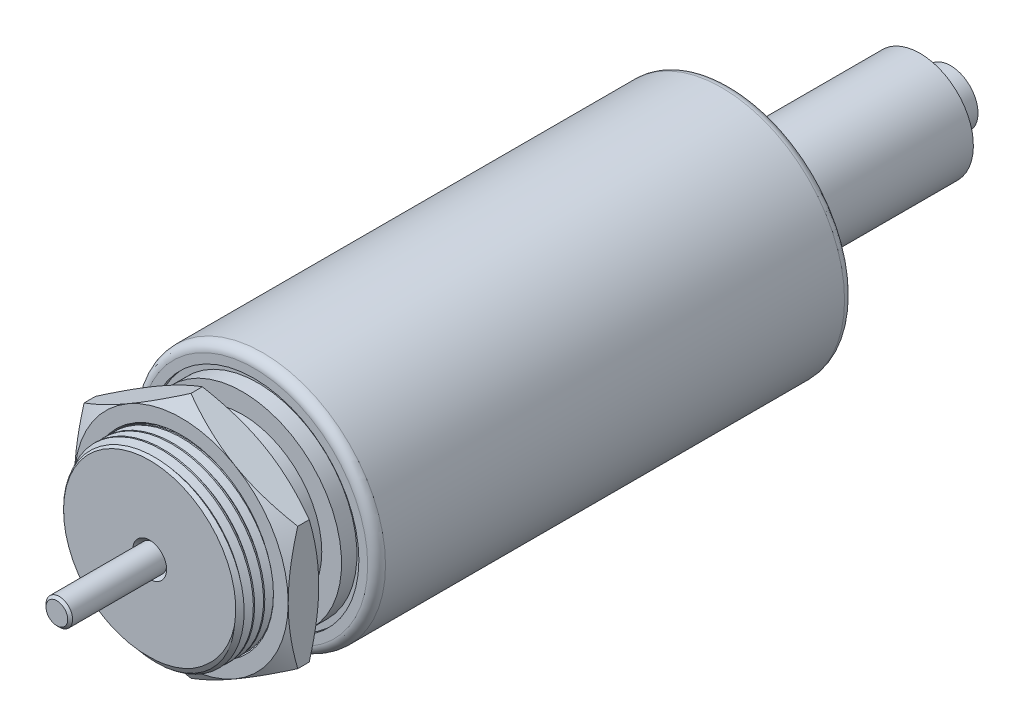
from build123d import *

# Parameters (mm, degrees)
CUT_SWEEP1_PITCH    = 1.058333333
BOSS_EXTRUDE3_START = 3.175
SKETCH10_R          = 9.46404
BOSS_EXTRUDE3_DEPTH = 3.175


with BuildPart() as part:
    # Sketch1 → Revolve1 (revolve)
    with BuildSketch(Plane(origin=(0, 0, 0), x_dir=(0, 0, -1), z_dir=(1, 0, 0)), mode=Mode.PRIVATE) as revolve1_sk:
        with BuildLine():
            Line((49.8729, 12.7635), (2.1209, 12.7635))
            ThreePointArc((2.1209, 12.7635), (1.465341303, 12.491958697), (1.1938, 11.8364))
            Line((1.1938, 11.8364), (1.1938, 10.922))
            Line((1.1938, 10.922), (1.6002, 10.922))
            Line((1.6002, 10.922), (1.6002, 10.3124))
            Line((1.6002, 10.3124), (0, 10.3124))
            Line((0, 10.3124), (0, 5.5499))
            Line((0, 5.5499), (50.8, 5.5499))
            Line((50.8, 5.5499), (50.8, 11.8364))
            ThreePointArc((50.8, 11.8364), (50.528458697, 12.491958697), (49.8729, 12.7635))
        make_face()
    revolve(revolve1_sk.sketch.rotate(Axis((0, 0, -50.8), (0, 0, 1)), 90), axis=Axis((0, 0, -50.8), (0, 0, 1)))

    # Sketch2 → Revolve2 (revolve)
    with BuildSketch(Plane(origin=(0, 0, 0), x_dir=(0, 0, -1), z_dir=(1, 0, 0))):
        Polygon((-9.652, 1.7653), (-9.652, 8.95604), (-9.144, 9.46404), (-2.47904, 9.46404), (-1.27, 8.255), (0, 8.255), (0, 1.3843), (-9.271, 1.3843), align=None)
    revolve(axis=Axis((0, 0, 0), (0, 0, 1)))

    # Cut-Sweep1: the profile of Sketch7 screwed along a right-hand helix of 8.92 turns, 8 arcs to a turn; built about Z, then put on its axis
    cut_sweep1_z = Axis((0, 0, 0), (0, 0, 1))
    cut_sweep1_corners = [(8.776632336, 0, -0.529166667), (8.776632336, 0, -0.396875), (9.521323972, 0, 0.033072917), (9.521323972, 0, -0.959114583)]
    with BuildLine(mode=Mode.PRIVATE) as cut_sweep1_profile:
        Line(cut_sweep1_corners[0], cut_sweep1_corners[1])
        Line(cut_sweep1_corners[1], cut_sweep1_corners[2])
        Line(cut_sweep1_corners[2], cut_sweep1_corners[3])
        Line(cut_sweep1_corners[3], cut_sweep1_corners[0])
    cut_sweep1_cap = Face(cut_sweep1_profile.wire())
    cut_sweep1_turn_angles = [0, 22.5, 45, 67.5, 90, 112.5, 135, 157.5, 180, 202.5, 225, 247.5, 270, 292.5, 315, 337.5, 360]
    cut_sweep1_turn_weights = [1, 0.9238795325112867, 1, 0.9238795325112867, 1, 0.9238795325112867, 1, 0.9238795325112867, 1, 0.9238795325112867, 1, 0.9238795325112867, 1, 0.9238795325112867, 1, 0.9238795325112867, 1]
    cut_sweep1_turn_rails = [Edge.make_bspline([Vector(p[0], p[1], 0).rotate(cut_sweep1_z, cut_sweep1_turn_angles[k]) / cut_sweep1_turn_weights[k] + Vector(0, 0, p[2] + CUT_SWEEP1_PITCH * cut_sweep1_turn_angles[k] / 360) for k in range(17)], [0, 0, 0, 1, 1, 2, 2, 3, 3, 4, 4, 5, 5, 6, 6, 7, 7, 8, 8, 8], 2, cut_sweep1_turn_weights) for p in cut_sweep1_corners]
    cut_sweep1_turn_sides = [Face.make_surface_from_curves(cut_sweep1_turn_rails[p[0]], cut_sweep1_turn_rails[p[1]]) for p in [(0, 1), (1, 2), (2, 3), (3, 0)]]
    cut_sweep1_last_angles = [2880, 2902.5, 2925, 2947.5, 2970, 2992.5, 3015, 3037.5, 3060, 3082.5, 3105, 3127.5, 3150, 3172.5, 3195, 3203.1, 3211.2]
    cut_sweep1_last_weights = [1, 0.9238795325112867, 1, 0.9238795325112867, 1, 0.9238795325112867, 1, 0.9238795325112867, 1, 0.9238795325112867, 1, 0.9238795325112867, 1, 0.9238795325112867, 1, 0.990023657716541, 1]
    cut_sweep1_last_rails = [Edge.make_bspline([Vector(p[0], p[1], 0).rotate(cut_sweep1_z, cut_sweep1_last_angles[k]) / cut_sweep1_last_weights[k] + Vector(0, 0, p[2] + CUT_SWEEP1_PITCH * cut_sweep1_last_angles[k] / 360) for k in range(17)], [0, 0, 0, 1, 1, 2, 2, 3, 3, 4, 4, 5, 5, 6, 6, 7, 7, 8, 8, 8], 2, cut_sweep1_last_weights) for p in cut_sweep1_corners]
    cut_sweep1_last_sides = [Face.make_surface_from_curves(cut_sweep1_last_rails[p[0]], cut_sweep1_last_rails[p[1]]) for p in [(0, 1), (1, 2), (2, 3), (3, 0)]]
    cut_sweep1 = Plane(origin=(0, 0, 9.652), x_dir=(0, 1, 0), z_dir=(0, 0, -1)) * Solid(Shell([*[p.moved(Location((0, 0, CUT_SWEEP1_PITCH * i))) for i in range(8) for p in cut_sweep1_turn_sides], *cut_sweep1_last_sides, cut_sweep1_cap, cut_sweep1_cap.rotate(cut_sweep1_z, 3211.2).moved(Location((0, 0, CUT_SWEEP1_PITCH * 3211.2 / 360)))]))
    add(cut_sweep1, mode=Mode.SUBTRACT)


with BuildPart() as body_2:
    # Sketch3 → Revolve3 (revolve)
    with BuildSketch(Plane(origin=(0, 0, 0), x_dir=(0, 0, -1), z_dir=(1, 0, 0))):
        Polygon((-19.05, 1.3843), (-19.304, 1.1303), (-19.304, 0), (73.66, 0), (73.66, 2.8575), (70.485, 2.8575), (70.485, 5.5499), (12.7, 5.5499), (12.7, 1.3843), align=None)
    revolve(axis=Axis((0, 0, -73.66), (0, 0, 1)))


with BuildPart() as body_3:
    # Body-Move/Copy1: copy of body 2
    add(body_2.part.moved(Location((0, 0, 12.7))))


with BuildPart() as body_3_2:
    # Sketch10 → Boss-Extrude3 (new body)
    with BuildSketch(Plane.XY.offset(BOSS_EXTRUDE3_START)):
        Polygon((0, 12.831609733), (-11.1125, 6.415804866), (-11.1125, -6.415804866), (0, -12.831609733), (11.1125, -6.415804866), (11.1125, 6.415804866), align=None)
        Circle(SKETCH10_R, mode=Mode.SUBTRACT)
    extrude(amount=BOSS_EXTRUDE3_DEPTH)

    # Sketch11 → Cut-Revolve1 (revolve, cut)
    with BuildSketch(Plane(origin=(0, 0, 0), x_dir=(0, 0, -1), z_dir=(1, 0, 0)), mode=Mode.PRIVATE) as cut_revolve1_sk:
        Polygon((-6.35, 12.831609733), (-6.35, 11.1125), (-5.357471533, 12.831609733), align=None)
        Polygon((-3.175, 12.831609733), (-3.175, 11.1125), (-4.167528467, 12.831609733), align=None)
        Polygon((-6.35, 9.578607944), (-6.35, 9.46404), (-6.235432056, 9.46404), align=None)
        Polygon((-3.175, 9.578607944), (-3.175, 9.46404), (-3.289567944, 9.46404), align=None)
    revolve(cut_revolve1_sk.sketch.rotate(Axis((0, 0, 6.35), (0, 0, -1)), 90), axis=Axis((0, 0, 6.35), (0, 0, -1)), mode=Mode.SUBTRACT)


solid = Compound([part.part, body_2.part, body_3_2.part])
